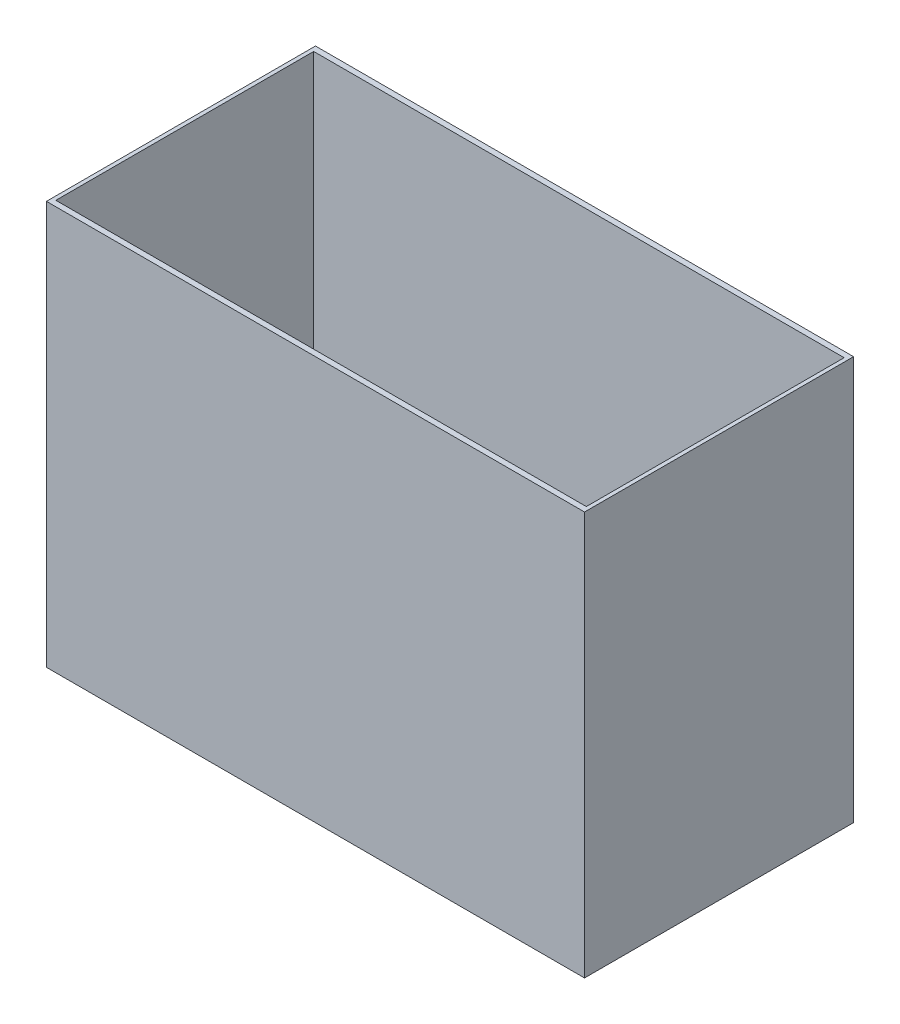
from build123d import *

# Parameters (mm, degrees)
SKETCH1_W           = 584.2
SKETCH1_H           = 279.4
BOSS_EXTRUDE1_DEPTH = 12.7
SKETCH3_W           = 609.6
SKETCH3_H           = 304.8
SKETCH3_W_2         = 600.964
SKETCH3_H_2         = 292.1
BOSS_EXTRUDE3_DEPTH = 457.2
SKETCH4_R           = 2.778125
CUT_EXTRUDE1_DEPTH  = 561.097357608
SKETCH6_R           = 6.35
CUT_EXTRUDE2_DEPTH  = 2.54
SKETCH7_R           = 2.778125
CUT_EXTRUDE3_DEPTH  = 561.097357608
SKETCH8_R           = 1.984375
CUT_EXTRUDE4_DEPTH  = 561.097357608
SKETCH9_R           = 6.35
CUT_EXTRUDE5_DEPTH  = 3.175


with BuildPart() as part:
    # Sketch1 → Boss-Extrude1 (new body)
    with BuildSketch(Plane(origin=(0, 0, 0), x_dir=(1, 0, 0), z_dir=(0, 1, 0))):
        Rectangle(SKETCH1_W, SKETCH1_H)
    extrude(amount=BOSS_EXTRUDE1_DEPTH)

    # Sketch4 → Cut-Extrude1 (cut, through all)
    with BuildSketch(Plane(origin=(0, 12.7, 0), x_dir=(1, 0, 0), z_dir=(0, 1, 0))):
        with Locations((273.05, 120.65)):
            Circle(SKETCH4_R)
    cut_extrude1 = extrude(amount=-CUT_EXTRUDE1_DEPTH, mode=Mode.SUBTRACT)

    # Sketch6 → Cut-Extrude2 (cut)
    with BuildSketch(Plane.XZ):
        with Locations((273.05, -120.65)):
            Circle(SKETCH6_R)
    cut_extrude2 = extrude(amount=-CUT_EXTRUDE2_DEPTH, mode=Mode.SUBTRACT)

    # Mirror1: Cut-Extrude1, Cut-Extrude2 across plane
    add(cut_extrude1.mirror(Plane.XY), mode=Mode.SUBTRACT)
    add(cut_extrude2.mirror(Plane.XY), mode=Mode.SUBTRACT)

    # Sketch7 → Cut-Extrude3 (cut, through all)
    with BuildSketch(Plane(origin=(0, 12.7, 0), x_dir=(1, 0, 0), z_dir=(0, 1, 0))):
        with Locations((190.5, 0)):
            Circle(SKETCH7_R)
    extrude(amount=-CUT_EXTRUDE3_DEPTH, mode=Mode.SUBTRACT)

    # Sketch8 → Cut-Extrude4 (cut, through all)
    with BuildSketch(Plane(origin=(0, 12.7, 0), x_dir=(1, 0, 0), z_dir=(0, 1, 0))):
        with Locations((94.9, -12.8415)):
            Circle(SKETCH8_R)
        with Locations((146.1, -12.8415)):
            Circle(SKETCH8_R)
        with Locations((146.1, 12.8415)):
            Circle(SKETCH8_R)
        with Locations((94.9, 12.8415)):
            Circle(SKETCH8_R)
    extrude(amount=-CUT_EXTRUDE4_DEPTH, mode=Mode.SUBTRACT)

    # Sketch9 → Cut-Extrude5 (cut)
    with BuildSketch(Plane.XZ):
        with Locations((190.5, 0)):
            Circle(SKETCH9_R)
        with Locations((146.1, 12.8415)):
            Circle(SKETCH9_R)
        with Locations((94.9, 12.8415)):
            Circle(SKETCH9_R)
        with Locations((94.9, -12.8415)):
            Circle(SKETCH9_R)
        with Locations((146.1, -12.8415)):
            Circle(SKETCH9_R)
    extrude(amount=-CUT_EXTRUDE5_DEPTH, mode=Mode.SUBTRACT)


with BuildPart() as body_2:
    # Sketch3 → Boss-Extrude3 (new body)
    with BuildSketch(Plane(origin=(0, 0, 0), x_dir=(1, 0, 0), z_dir=(0, 1, 0))):
        Rectangle(SKETCH3_W, SKETCH3_H)
        Rectangle(SKETCH3_W_2, SKETCH3_H_2, mode=Mode.SUBTRACT)
    extrude(amount=BOSS_EXTRUDE3_DEPTH)


solid = Compound([part.part, body_2.part])
